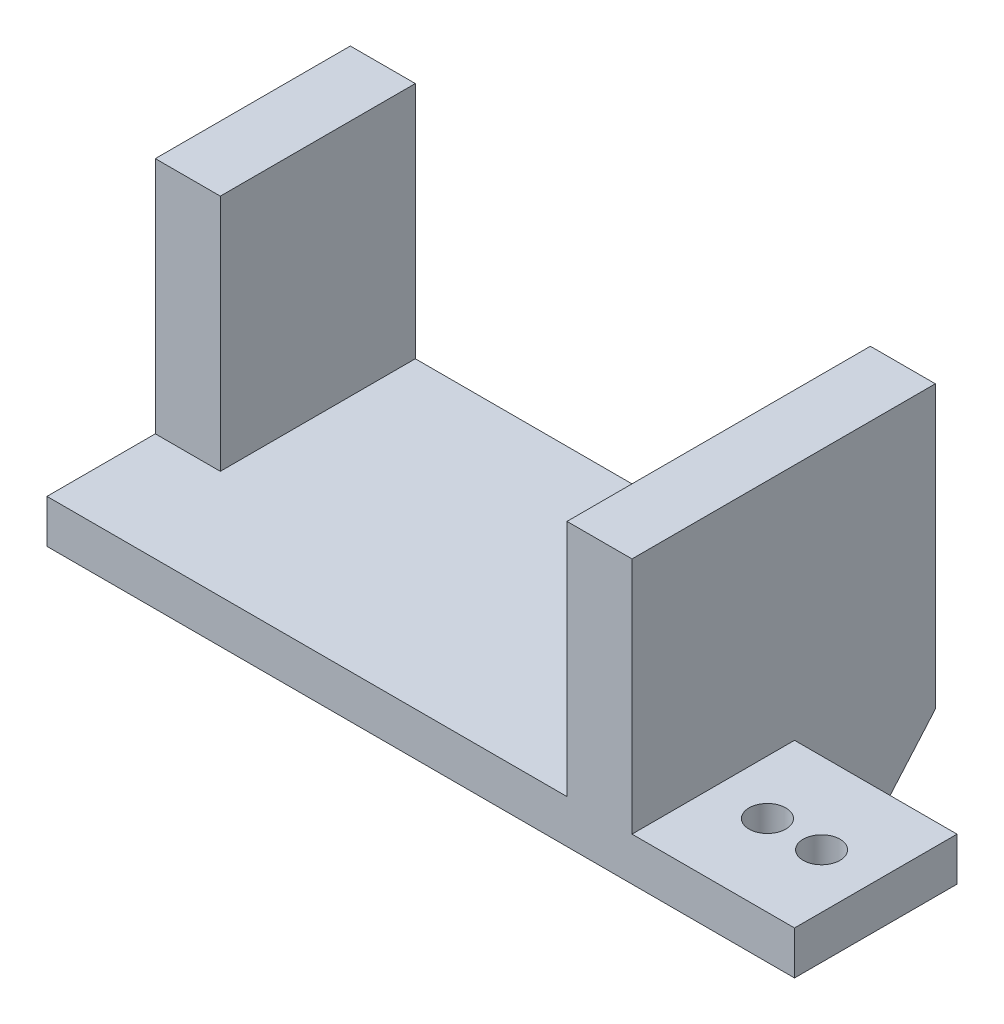
from build123d import *

# Parameters (mm, degrees)
BOSS_EXTRUDE1_DEPTH = 15
BOSS_EXTRUDE2_DEPTH = 13
SKETCH3_R           = 1.8
CUT_EXTRUDE1_DEPTH  = 10
SKETCH4_W           = 15
SKETCH4_H           = 15
SKETCH4_R           = 1.7
CUT_EXTRUDE2_DEPTH  = 15
SKETCH5_W           = 6
SKETCH5_H           = 10
CUT_EXTRUDE3_DEPTH  = 22
BOSS_EXTRUDE3_DEPTH = 54
SKETCH7_W           = 18
SKETCH7_H           = 15
CUT_EXTRUDE4_DEPTH  = 11


with BuildPart() as part:
    # Sketch1 → Boss-Extrude1 (new body)
    with BuildSketch(Plane.XY):
        Polygon((-21, 4), (-21, 26), (-27, 26), (-27, 4), (-42, 4), (-42, 0), (42, 0), (42, 4), (27, 4), (27, 26), (21, 26), (21, 4), align=None)
    extrude(amount=BOSS_EXTRUDE1_DEPTH)

    # Sketch2 → Boss-Extrude2 (add)
    with BuildSketch(Plane(origin=(0, 0, 0), x_dir=(-1, 0, 0), z_dir=(0, 0, -1))):
        Polygon((-27, 26), (-27, 0), (27, 0), (27, 4), (27, 26), (21, 26), (21, 4), (-21, 4), (-21, 26), align=None)
    extrude(amount=BOSS_EXTRUDE2_DEPTH)

    # Sketch3 → Cut-Extrude1 (cut)
    with BuildSketch(Plane(origin=(0, 0, -13), x_dir=(-1, 0, 0), z_dir=(0, 0, -1))):
        with Locations((-24, 20.95)):
            Circle(SKETCH3_R)
        with Locations((-24, 11.05)):
            Circle(SKETCH3_R)
        with Locations((24, 20.95)):
            Circle(SKETCH3_R)
        with Locations((24, 11.05)):
            Circle(SKETCH3_R)
    extrude(amount=-CUT_EXTRUDE1_DEPTH, mode=Mode.SUBTRACT)

    # Sketch4 → Cut-Extrude2 (cut)
    with BuildSketch(Plane(origin=(0, 4, 0), x_dir=(1, 0, 0), z_dir=(0, 1, 0))):
        with Locations((-34.5, -7.5)):
            Rectangle(SKETCH4_W, SKETCH4_H)
        with Locations((37, -7.5)):
            Circle(SKETCH4_R)
        with Locations((32, -7.5)):
            Circle(SKETCH4_R)
    extrude(amount=-CUT_EXTRUDE2_DEPTH, mode=Mode.SUBTRACT)

    # Sketch5 → Cut-Extrude3 (cut)
    with BuildSketch(Plane(origin=(0, 26, 0), x_dir=(1, 0, 0), z_dir=(0, 1, 0))):
        with Locations((-24, -10)):
            Rectangle(SKETCH5_W, SKETCH5_H)
    extrude(amount=-CUT_EXTRUDE3_DEPTH, mode=Mode.SUBTRACT)

    # Sketch6 → Boss-Extrude3 (add)
    with BuildSketch(Plane.ZY.offset(27)):
        Polygon((-13, 0), (0, 0), (0, -15), align=None)
    extrude(amount=-BOSS_EXTRUDE3_DEPTH)

    # Sketch7 → Cut-Extrude4 (cut)
    with BuildSketch(Plane(origin=(0, 0, -13), x_dir=(-1, 0, 0), z_dir=(0, 0, -1))):
        with Locations((-12, -7.5)):
            Rectangle(SKETCH7_W, SKETCH7_H)
        with Locations((12, -7.5)):
            Rectangle(SKETCH7_W, SKETCH7_H)
    extrude(amount=-CUT_EXTRUDE4_DEPTH, mode=Mode.SUBTRACT)


solid = part.part
